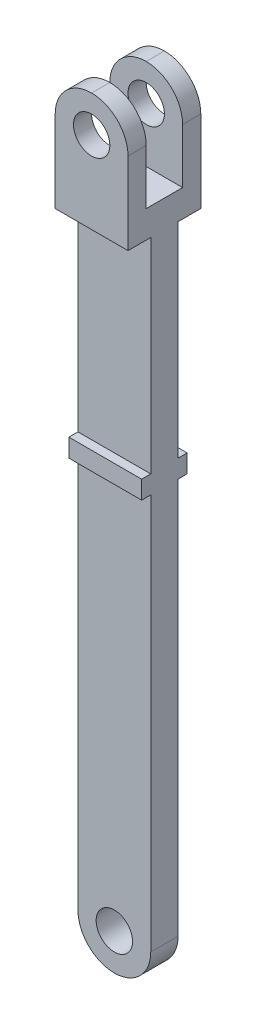
from build123d import *

# Parameters (mm, degrees)
CROQUIS1_W              = 8
CROQUIS1_H              = 75
SALIENTE_EXTRUIR1_DEPTH = 3
CROQUIS2_R              = 2
CORTAR_EXTRUIR1_DEPTH   = 43.793106922
CROQUIS3_W              = 8
CROQUIS3_H              = 2
SALIENTE_EXTRUIR2_DEPTH = 1
CROQUIS4_W              = 8
CROQUIS4_H              = 3
SALIENTE_EXTRUIR3_DEPTH = 2.5
CROQUIS5_W              = 8
CROQUIS5_H              = 2
SALIENTE_EXTRUIR4_DEPTH = 10
CROQUIS7_R              = 2
CORTAR_EXTRUIR3_DEPTH   = 18.5
REDONDEO2_R             = 4
REDONDEO5_R             = 4


with BuildPart() as part:
    # Croquis1 → Saliente-Extruir1 (new body)
    with BuildSketch(Plane.XY):
        with Locations((0, -5)):
            Rectangle(CROQUIS1_W, CROQUIS1_H)
    extrude(amount=SALIENTE_EXTRUIR1_DEPTH)

    # Croquis2 → Cortar-Extruir1 (cut, through all)
    with BuildSketch(Plane.XY.offset(3)):
        with Locations((0, -38.5)):
            Circle(CROQUIS2_R)
    extrude(amount=-CORTAR_EXTRUIR1_DEPTH, mode=Mode.SUBTRACT)

    # Croquis3 → Saliente-Extruir2 (add)
    with BuildSketch(Plane.XY.offset(3)):
        with Locations((0, 6)):
            Rectangle(CROQUIS3_W, CROQUIS3_H)
    saliente_extruir2 = extrude(amount=SALIENTE_EXTRUIR2_DEPTH)

    # Simetría1: Saliente-Extruir2 across plane
    add(saliente_extruir2.mirror(Plane.XY.offset(1.5)))

    # Croquis4 → Saliente-Extruir3 (add)
    with BuildSketch(Plane(origin=(0, 0, 0), x_dir=(-1, 0, 0), z_dir=(0, 0, -1))):
        with Locations((0, 31)):
            Rectangle(CROQUIS4_W, CROQUIS4_H)
    saliente_extruir3 = extrude(amount=SALIENTE_EXTRUIR3_DEPTH)

    # Croquis5 → Saliente-Extruir4 (add)
    with BuildSketch(Plane(origin=(0, 32.5, 0), x_dir=(1, 0, 0), z_dir=(0, 1, 0))):
        with Locations((0, 1.5)):
            Rectangle(CROQUIS5_W, CROQUIS5_H)
    saliente_extruir4 = extrude(amount=SALIENTE_EXTRUIR4_DEPTH)

    # Croquis7 → Cortar-Extruir3 (cut)
    with BuildSketch(Plane(origin=(0, 0, -2.5), x_dir=(-1, 0, 0), z_dir=(0, 0, -1))):
        with Locations((0, 38.5)):
            Circle(CROQUIS7_R)
    cortar_extruir3 = extrude(amount=-CORTAR_EXTRUIR3_DEPTH, mode=Mode.SUBTRACT)

    # Redondeo2
    redondeo2_edges = [part.edges().sort_by_distance(p)[0] for p in [
        (4, 42.5, -1.5),
        (-4, 42.5, -1.5),
        (-4, -42.5, 1.5),
        (4, -42.5, 1.5),
    ]]
    fillet(redondeo2_edges, radius=REDONDEO2_R - 0.0001)  # a hair under: the kernel refuses the full size

    # Simetría3: Saliente-Extruir3, Saliente-Extruir4, Cortar-Extruir3 across plane
    add(saliente_extruir3.mirror(Plane.XY.offset(1.5)))
    add(saliente_extruir4.mirror(Plane.XY.offset(1.5)))
    add(cortar_extruir3.mirror(Plane.XY.offset(1.5)), mode=Mode.SUBTRACT)

    # Redondeo5
    redondeo5_edges = [part.edges().sort_by_distance(p)[0] for p in [
        (-4, 42.5, 4.5),
        (4, 42.5, 4.5),
    ]]
    fillet(redondeo5_edges, radius=REDONDEO5_R - 0.0001)  # a hair under: the kernel refuses the full size


solid = part.part
